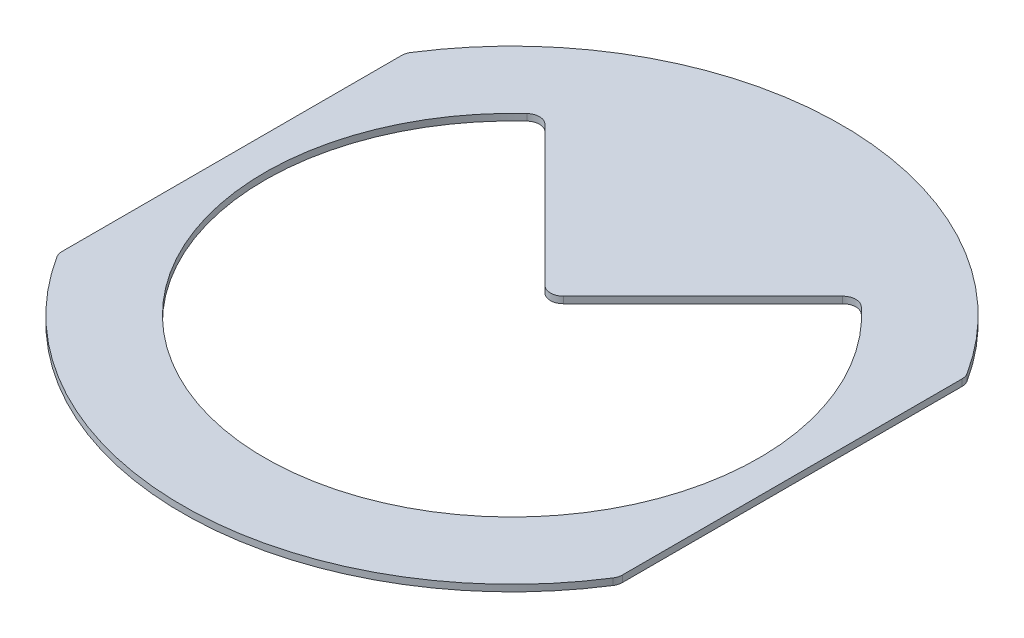
from build123d import *

# Parameters (mm, degrees)
BOSS_EXTRUDE1_DEPTH = 1
FILLET1_R           = 2


with BuildPart() as part:
    # Sketch1 → Boss-Extrude1 (new body)
    with BuildSketch(Plane(origin=(0, 0, 0), x_dir=(1, 0, 0), z_dir=(0, 1, 0))):
        with BuildLine():
            Line((-42.5, 26.339134382), (-42.5, -26.339134382))
            ThreePointArc((-42.5, -26.339134382), (0, -50), (42.5, -26.339134382))
            Line((42.5, -26.339134382), (42.5, 26.339134382))
            ThreePointArc((42.5, 26.339134382), (0, 50), (-42.5, 26.339134382))
        make_face()
        with BuildLine():
            Line((-23.898390102, 28.898390102), (0, 5))
            Line((0, 5), (23.898390102, 28.898390102))
            ThreePointArc((23.898390102, 28.898390102), (0, -37.5), (-23.898390102, 28.898390102))
        make_face(mode=Mode.SUBTRACT)
    extrude(amount=BOSS_EXTRUDE1_DEPTH)

    # Fillet1
    fillet1_edges = [part.edges().sort_by_distance(p)[0] for p in [
        (-23.898390102, 0.5, -28.898390102),
        (23.898390102, 0.5, -28.898390102),
        (42.5, 0.5, -26.339134382),
        (42.5, 0.5, 26.339134382),
        (-42.5, 0.5, 26.339134382),
        (-42.5, 0.5, -26.339134382),
        (0, 0.5, -5),
    ]]
    fillet(fillet1_edges, radius=FILLET1_R)


solid = part.part
